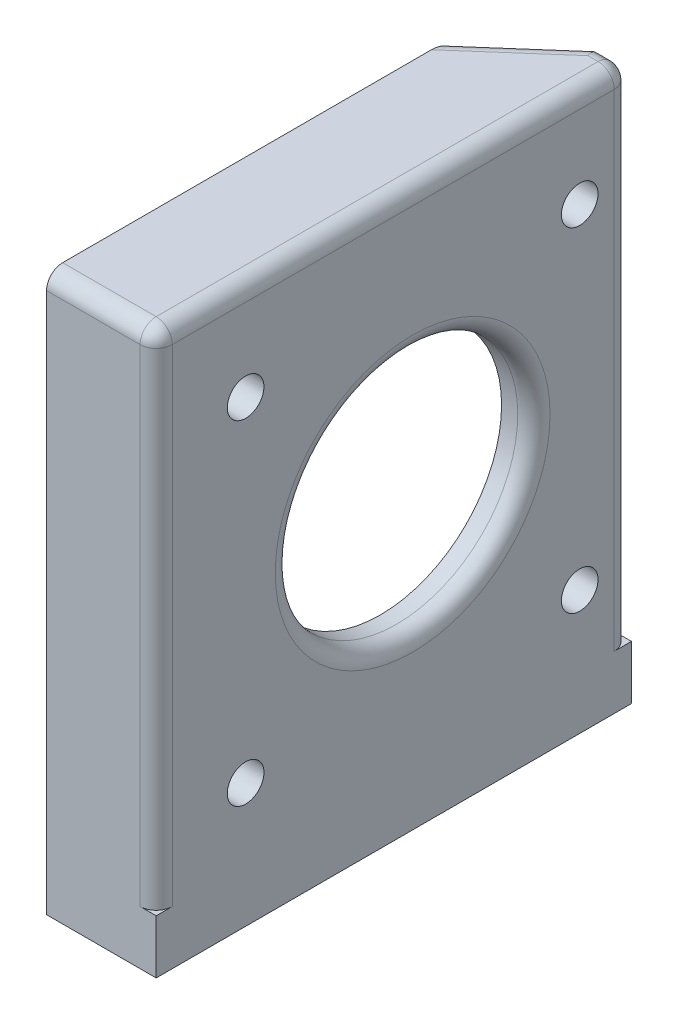
from build123d import *

# Parameters (mm, degrees)
SKETCH_1_W            = 5
SKETCH_1_H            = 60
SKETCH_1_W_2          = 30
SKETCH_1_H_2          = 5
SKETCH_1_W_3          = 15
EXTRUDE_1_DEPTH       = 5
FILLET_1_R            = 5
SKETCH_2_W            = 245
SKETCH_2_H            = 125
CUT_EXTRUDE_1_DEPTH   = 5
SKETCH_3_W            = 110
SKETCH_3_H            = 2.5
SKETCH_3_W_2          = 115
CUT_EXTRUDE_2_DEPTH   = 10
SKETCH_4_W            = 5
SKETCH_4_H            = 5
CUT_EXTRUDE_3_DEPTH   = 5
SKETCH_5_W            = 50
SKETCH_5_H            = 46.65
EXTRUDE_2_DEPTH       = 47
SKETCH_6_W            = 41.4
SKETCH_6_H            = 44.05
CUT_EXTRUDE_4_DEPTH   = 47
SKETCH_7_R            = 11.25
CUT_EXTRUDE_5_DEPTH   = 317.004529962
CUT_EXTRUDE_6_DEPTH   = 46.65
SKETCH_10_R           = 1.7
CUT_EXTRUDE_7_DEPTH   = 317.004529962
SKETCH_13_R           = 25
CUT_EXTRUDE_9_DEPTH   = 20
FILLET_11_R           = 1.497
SKETCH_17_OUTSIDE_W   = 295.14
SKETCH_17_OUTSIDE_H   = 275.14
SKETCH_17_OUTSIDE_W_2 = 10.174383679
SKETCH_17_OUTSIDE_H_2 = 44.104202059
CUT_EXTRUDE_11_DEPTH  = 359.196699


with BuildPart() as part:
    # 草圖1 → 填料-伸長1 (new body)
    with BuildSketch(Plane(origin=(0, 0, 0), x_dir=(1, 0, 0), z_dir=(0, 1, 0))):
        Polygon((198.746286718, -286.464902661), (198.746286718, -256.464902661), (183.246286718, -256.464902661), (183.246286718, -266.464902661), (124.746286718, -266.464902661), (124.746286718, -262.464902661), (109.246286718, -262.464902661), (109.246286718, -266.464902661), (-21.253713282, -266.464902661), (-21.253713282, 38.535097339), (-36.253713282, 38.535097339), (-36.253713282, 43.535097339), (203.746286718, 43.535097339), (203.746286718, -286.464902661), align=None)
        with Locations((206.246286718, -256.464902661)):
            Rectangle(SKETCH_1_W, SKETCH_1_H)
        with Locations((206.246286718, 13.535097339)):
            Rectangle(SKETCH_1_W, SKETCH_1_H)
        with Locations((188.746286718, 46.035097339)):
            Rectangle(SKETCH_1_W_2, SKETCH_1_H_2)
        with Locations((-21.253713282, 46.035097339)):
            Rectangle(SKETCH_1_W_2, SKETCH_1_H_2)
        with Locations((91.246286718, 46.035097339)):
            Rectangle(SKETCH_1_W_3, SKETCH_1_H_2)
        with Locations((76.246286718, 46.035097339)):
            Rectangle(SKETCH_1_W_3, SKETCH_1_H_2)
        with Locations((206.246286718, -166.464902661)):
            Rectangle(SKETCH_1_W, SKETCH_1_H)
        with Locations((206.246286718, -76.464902661)):
            Rectangle(SKETCH_1_W, SKETCH_1_H)
    extrude(amount=EXTRUDE_1_DEPTH)

    # 圓角1
    fillet_1_edges = [part.edges().sort_by_distance(p)[0] for p in [
        (208.746286718, 5, -13.535097339),
        (208.746286718, 5, 76.464902661),
        (208.746286718, 5, 166.464902661),
        (208.746286718, 5, 256.464902661),
    ]]
    fillet(fillet_1_edges, radius=FILLET_1_R - 0.0001)  # a hair under: the kernel refuses the full size

    # 草圖2 → 除料-伸長1 (cut)
    with BuildSketch(Plane(origin=(0, 5, 0), x_dir=(1, 0, 0), z_dir=(0, 1, 0))):
        with Locations((86.246286718, -13.964902661)):
            Rectangle(SKETCH_2_W, SKETCH_2_H)
    extrude(amount=-CUT_EXTRUDE_1_DEPTH, mode=Mode.SUBTRACT)

    # 草圖3 → 除料-伸長2 (cut)
    with BuildSketch(Plane(origin=(0, 0, 76.464902661), x_dir=(-1, 0, 0), z_dir=(0, 0, -1))):
        with Locations((-33.746286718, 1.25)):
            Rectangle(SKETCH_3_W, SKETCH_3_H)
        with Locations((-151.246286718, 3.75)):
            Rectangle(SKETCH_3_W_2, SKETCH_3_H)
    extrude(amount=-CUT_EXTRUDE_2_DEPTH, mode=Mode.SUBTRACT)

    # 草圖4 → 除料-伸長3 (cut)
    with BuildSketch(Plane(origin=(0, 0, 76.464902661), x_dir=(-1, 0, 0), z_dir=(0, 0, -1))):
        with Locations((-91.246286718, 2.5)):
            Rectangle(SKETCH_4_W, SKETCH_4_H)
    extrude(amount=-CUT_EXTRUDE_3_DEPTH, mode=Mode.SUBTRACT)

    # 草圖5 → 填料-伸長2 (add)
    with BuildSketch(Plane.XY.offset(266.464902661)):
        with Locations((79.746286718, 28.325)):
            Rectangle(SKETCH_5_W, SKETCH_5_H)
    extrude(amount=-EXTRUDE_2_DEPTH)

    # 草圖6 → 除料-伸長4 (cut)
    with BuildSketch(Plane.ZY.offset(-54.746286718)):
        with Locations((242.964902661, 27.025)):
            Rectangle(SKETCH_6_W, SKETCH_6_H)
    extrude(amount=-CUT_EXTRUDE_4_DEPTH, mode=Mode.SUBTRACT)

    # 草圖7 → 除料-伸長5 (cut, through all)
    with BuildSketch(Plane.ZY.offset(-101.746286718)):
        with Locations((242.664902661, 27.025)):
            Circle(SKETCH_7_R)
    extrude(amount=-CUT_EXTRUDE_5_DEPTH, mode=Mode.SUBTRACT)

    # 草圖8 → 除料-伸長6 (cut)
    with BuildSketch(Plane(origin=(0, 51.65, 0), x_dir=(1, 0, 0), z_dir=(0, 1, 0))):
        Polygon((54.746286718, -263.664902661), (101.746286718, -222.464902661), (104.746286718, -222.464902661), (104.746286718, -219.464902661), (54.746286718, -219.464902661), align=None)
    extrude(amount=-CUT_EXTRUDE_6_DEPTH, mode=Mode.SUBTRACT)

    # 草圖10 → 除料-伸長7 (cut, through all)
    with BuildSketch(Plane.ZY.offset(-101.746286718)):
        with Locations((227.164902661, 42.525)):
            Circle(SKETCH_10_R)
        with Locations((258.164902661, 42.525)):
            Circle(SKETCH_10_R)
        with Locations((258.164902661, 11.525)):
            Circle(SKETCH_10_R)
        with Locations((227.164902661, 11.525)):
            Circle(SKETCH_10_R)
    extrude(amount=-CUT_EXTRUDE_7_DEPTH, mode=Mode.SUBTRACT)

    # 草圖13 → 除料-伸長9 (cut)
    with BuildSketch(Plane(origin=(104.746286718, 0, 0), x_dir=(0, 0, -1), z_dir=(1, 0, 0))):
        with Locations((-242.664902661, 27.025)):
            Circle(SKETCH_13_R)
    extrude(amount=CUT_EXTRUDE_9_DEPTH, mode=Mode.SUBTRACT)

    # 圓角11
    fillet_11_edges = [part.edges().sort_by_distance(p)[0] for p in [
        (54.746286718, 28.325, 266.464902661),
        (79.746286718, 51.65, 266.464902661),
        (104.746286718, 28.325, 266.464902661),
        (104.746286718, 27.025, 231.414902661),
        (54.746286718, 51.65, 265.064902661),
        (104.746286718, 51.65, 244.464902661),
        (104.746286718, 28.325, 222.464902661),
        (78.246286718, 51.65, 243.064902661),
        (103.246286718, 51.65, 222.464902661),
    ]]
    fillet(fillet_11_edges, radius=FILLET_11_R)

    # 草圖17 outside → 除料-伸長11 (cut, through all)
    with BuildSketch(Plane(origin=(0, 51.65, 0), x_dir=(1, 0, 0), z_dir=(0, 1, 0))):
        with Locations((93.746, -181.465)):
            Rectangle(SKETCH_17_OUTSIDE_W, SKETCH_17_OUTSIDE_H)
        with Locations((99.659094879, -244.412801632)):
            Rectangle(SKETCH_17_OUTSIDE_W_2, SKETCH_17_OUTSIDE_H_2, mode=Mode.SUBTRACT)
    extrude(amount=-CUT_EXTRUDE_11_DEPTH, mode=Mode.SUBTRACT)


solid = part.part
